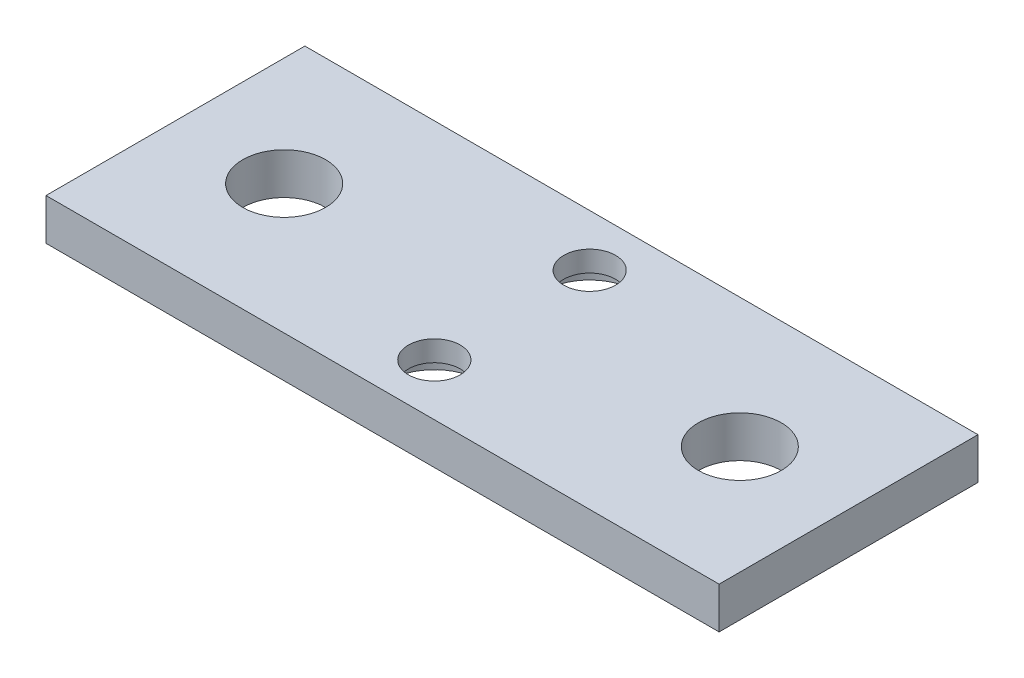
from build123d import *

# Parameters (mm, degrees)
SKETCH_1_W          = 65
SKETCH_1_H          = 25
EXTRUDE_1_DEPTH     = 4
SKETCH_2_W          = 15
SKETCH_2_H          = 25
EXTRUDE_2_DEPTH     = 13
SKETCH_3_R          = 2.5
SKETCH_3_R_2        = 4
CUT_EXTRUDE_1_DEPTH = 39.74919354
SKETCH_4_R          = 4.5
CUT_EXTRUDE_2_DEPTH = 2
SKETCH_5_W          = 15
SKETCH_5_H          = 4
EXTRUDE_3_DEPTH     = 6
SKETCH_6_R          = 1.25
CUT_EXTRUDE_3_DEPTH = 40.59166579
FILLET_2_R          = 3
SKETCH_9_W          = 15
SKETCH_9_H          = 13
CUT_EXTRUDE_4_DEPTH = 53.098464469


with BuildPart() as part:
    # 草图1 → 凸台-拉伸1 (new body)
    with BuildSketch(Plane(origin=(0, 0, 0), x_dir=(1, 0, 0), z_dir=(0, 1, 0))):
        Rectangle(SKETCH_1_W, SKETCH_1_H)
    extrude(amount=EXTRUDE_1_DEPTH)

    # 草图2 → 凸台-拉伸2 (add)
    with BuildSketch(Plane(origin=(0, 4, 0), x_dir=(1, 0, 0), z_dir=(0, 1, 0))):
        Rectangle(SKETCH_2_W, SKETCH_2_H)
    extrude(amount=EXTRUDE_2_DEPTH)

    # 草图3 → 切除-拉伸1 (cut, through all)
    with BuildSketch(Plane.XZ):
        with Locations((0, -7.5)):
            Circle(SKETCH_3_R)
        with Locations((0, 7.5)):
            Circle(SKETCH_3_R)
        with Locations((-22, 0)):
            Circle(SKETCH_3_R_2)
        with Locations((22, 0)):
            Circle(SKETCH_3_R_2)
    extrude(amount=-CUT_EXTRUDE_1_DEPTH, mode=Mode.SUBTRACT)

    # 草图4 → 切除-拉伸2 (cut)
    with BuildSketch(Plane.XZ):
        with Locations((0, -7.5)):
            Circle(SKETCH_4_R)
        with Locations((0, 7.5)):
            Circle(SKETCH_4_R)
    extrude(amount=-CUT_EXTRUDE_2_DEPTH, mode=Mode.SUBTRACT)

    # 草图5 → 凸台-拉伸3 (add)
    with BuildSketch(Plane.XY.offset(12.5)):
        with Locations((0, 6)):
            Rectangle(SKETCH_5_W, SKETCH_5_H)
    extrude_3 = extrude(amount=EXTRUDE_3_DEPTH)

    # 草图6 → 切除-拉伸3 (cut, through all)
    with BuildSketch(Plane.XZ.offset(-4)):
        with Locations((-4.5, 15.5)):
            Circle(SKETCH_6_R)
        with Locations((4.5, 15.5)):
            Circle(SKETCH_6_R)
    cut_extrude_3 = extrude(amount=-CUT_EXTRUDE_3_DEPTH, mode=Mode.SUBTRACT)

    # 镜向2: 凸台-拉伸3, 切除-拉伸3 across plane
    add(extrude_3.mirror(Plane.XY))
    add(cut_extrude_3.mirror(Plane.XY), mode=Mode.SUBTRACT)

    # 圆角2
    fillet_2_edges = [part.edges().sort_by_distance(p)[0] for p in [
        (-7.5, 6, -18.5),
        (7.5, 6, -18.5),
        (-7.5, 6, 18.5),
        (7.5, 6, 18.5),
    ]]
    fillet(fillet_2_edges, radius=FILLET_2_R)

    # 草图9 → 切除-拉伸4 (cut, through all)
    with BuildSketch(Plane.XY.offset(18.5)):
        with Locations((0, 10.5)):
            Rectangle(SKETCH_9_W, SKETCH_9_H)
    extrude(amount=-CUT_EXTRUDE_4_DEPTH, mode=Mode.SUBTRACT)


solid = part.part
